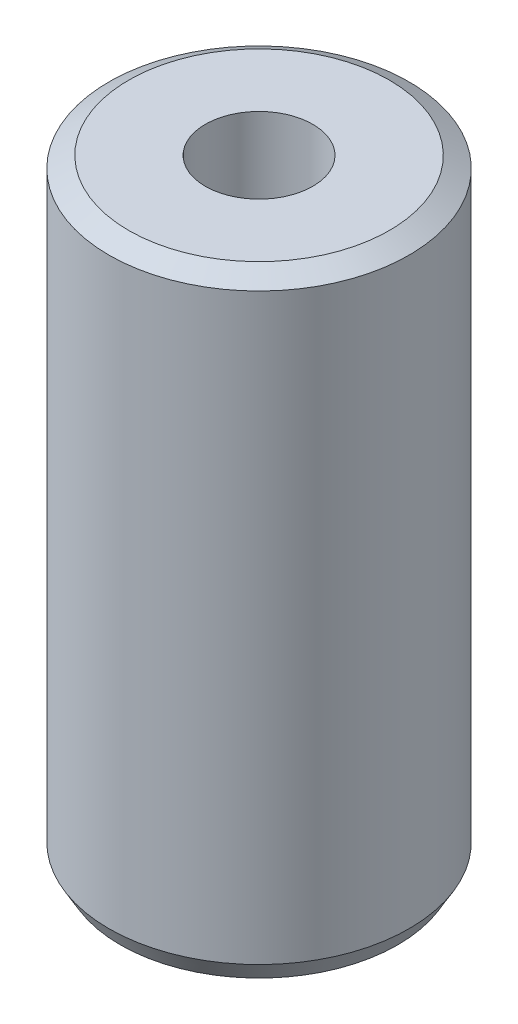
from build123d import *
from OCP.BRepFilletAPI import BRepFilletAPI_MakeChamfer

# Parameters (mm, degrees)
SKETCH1_R           = 57.5
BOSS_EXTRUDE1_DEPTH = 235.427013264
SKETCH2_R           = 20.589581862
CUT_EXTRUDE1_DEPTH  = 250.075046069
CHAMFER1_SIZE       = 4.37765695
CHAMFER1_SIZE2      = 7.582324255


with BuildPart() as part:
    # Sketch1 → Boss-Extrude1 (new body)
    with BuildSketch(Plane(origin=(0, 0, 0), x_dir=(1, 0, 0), z_dir=(0, 1, 0))):
        Circle(SKETCH1_R)
    extrude(amount=BOSS_EXTRUDE1_DEPTH)

    # Sketch2 → Cut-Extrude1 (cut, through all)
    with BuildSketch(Plane(origin=(0, 0, 0), x_dir=(1, 0, 0), z_dir=(0, 1, 0))):
        Circle(SKETCH2_R)
    extrude(amount=CUT_EXTRUDE1_DEPTH, mode=Mode.SUBTRACT)

    # Chamfer1: one chamfer whose edges measure the first distance from different faces: ONE call of the kernel's chamfer builder (chamfer() names one face for all edges)
    chamfer1_edges_1 = [part.edges().sort_by_distance(p)[0] for p in [
        (-57.5, 235.427013264, 0),
    ]]
    chamfer1_side_1 = [part.faces().sort_by_distance(p)[0] for p in [
        (-57.5, 117.713506632, 0),
    ]]
    chamfer1_edges_2 = [part.edges().sort_by_distance(p)[0] for p in [
        (-57.5, 0, 0),
    ]]
    chamfer1_side_2 = [part.faces().sort_by_distance(p)[0] for p in [
        (-55.873654403, 0, 0),
    ]]
    chamfer1 = BRepFilletAPI_MakeChamfer(part.part.solid().wrapped)
    for e in chamfer1_edges_1:
        chamfer1.Add(CHAMFER1_SIZE, CHAMFER1_SIZE2, e.wrapped, chamfer1_side_1[0].wrapped)  # the first distance lies on this face
    for e in chamfer1_edges_2:
        chamfer1.Add(CHAMFER1_SIZE, CHAMFER1_SIZE2, e.wrapped, chamfer1_side_2[0].wrapped)  # the first distance lies on this face
    add(Compound.cast(chamfer1.Shape()), mode=Mode.REPLACE)


solid = part.part
